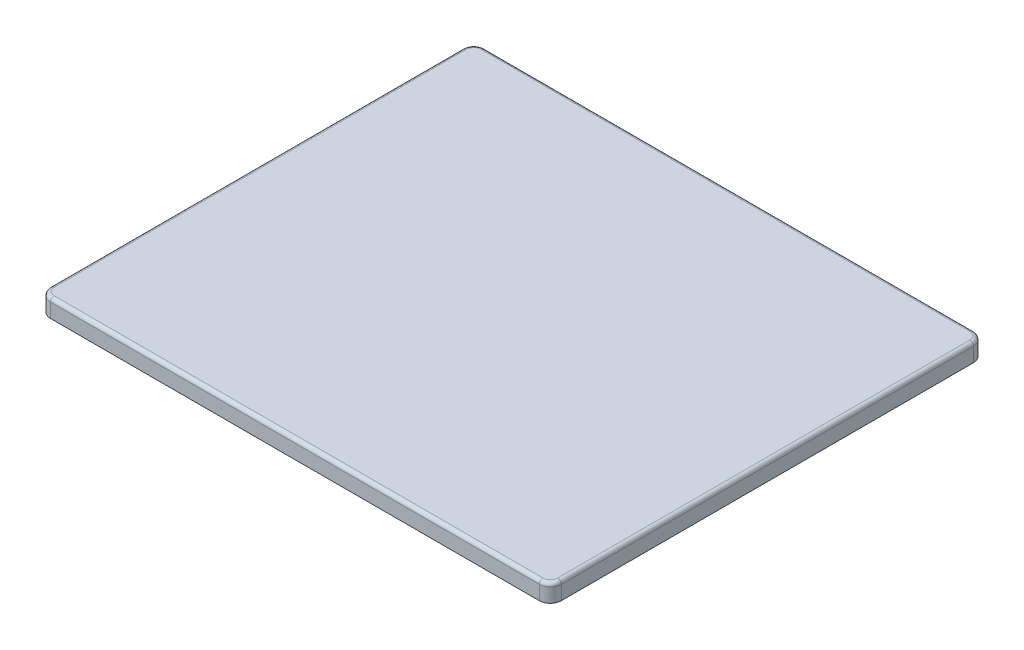
from build123d import *

# Parameters (mm, degrees)
SKETCH1_W           = 140
SKETCH1_H           = 119
BOSS_EXTRUDE1_DEPTH = 5
FILLET1_R           = 3
SHELL1_START        = -67
SHELL1_OUTLINE_W    = 2
SHELL1_OUTLINE_H    = 113
SHELL1_DEPTH        = 134
FILLET2_R           = 3
CUT_EXTRUDE1_DEPTH  = 1
CUT_EXTRUDE2_DEPTH  = 0.1
FILLET3_R           = 1
FILLET5_R           = 0.5


# Read off the part's stored shape, not the designer's step: Shell1
with BuildPart() as part:
    # Sketch1 → Boss-Extrude1 (new body)
    with BuildSketch(Plane(origin=(0, 0, 0), x_dir=(1, 0, 0), z_dir=(0, 1, 0))):
        Rectangle(SKETCH1_W, SKETCH1_H)
    extrude(amount=BOSS_EXTRUDE1_DEPTH)

    # Fillet1
    fillet1_edges = [part.edges().sort_by_distance(p)[0] for p in [
        (70, 2.5, 59.5),
        (-70, 2.5, 59.5),
        (-70, 2.5, -59.5),
        (70, 2.5, -59.5),
    ]]
    fillet(fillet1_edges, radius=FILLET1_R)

    # Shell1 outline → Shell1 (cut)
    with BuildSketch(Plane.YZ.offset(SHELL1_START)):
        with Locations((1, 0)):
            Rectangle(SHELL1_OUTLINE_W, SHELL1_OUTLINE_H)
    extrude(amount=SHELL1_DEPTH, mode=Mode.SUBTRACT)

    # Fillet2
    fillet2_edges = [part.edges().sort_by_distance(p)[0] for p in [
        (67, 1, -56.5),
        (-67, 1, -56.5),
        (-67, 1, 56.5),
        (67, 1, 56.5),
    ]]
    fillet(fillet2_edges, radius=FILLET2_R)

    # Sketch2 → Cut-Extrude1 (cut)
    with BuildSketch(Plane.XZ):
        with BuildLine():
            Line((68.5, -53.5), (68.5, 53.5))
            ThreePointArc((68.5, 53.5), (67.181980515, 56.681980515), (64, 58))
            Line((64, 58), (-64, 58))
            ThreePointArc((-64, 58), (-67.181980515, 56.681980515), (-68.5, 53.5))
            Line((-68.5, 53.5), (-68.5, -53.5))
            ThreePointArc((-68.5, -53.5), (-67.181980515, -56.681980515), (-64, -58))
            Line((-64, -58), (64, -58))
            ThreePointArc((64, -58), (67.181980515, -56.681980515), (68.5, -53.5))
        make_face()
        with BuildLine():
            Line((67, 53.5), (67, -53.5))
            ThreePointArc((67, -53.5), (66.121320344, -55.621320344), (64, -56.5))
            Line((64, -56.5), (-64, -56.5))
            ThreePointArc((-64, -56.5), (-66.121320344, -55.621320344), (-67, -53.5))
            Line((-67, -53.5), (-67, 53.5))
            ThreePointArc((-67, 53.5), (-66.121320344, 55.621320344), (-64, 56.5))
            Line((-64, 56.5), (64, 56.5))
            ThreePointArc((64, 56.5), (66.121320344, 55.621320344), (67, 53.5))
        make_face(mode=Mode.SUBTRACT)
    extrude(amount=-CUT_EXTRUDE1_DEPTH, mode=Mode.SUBTRACT)

    # Sketch3 → Cut-Extrude2 (cut)
    with BuildSketch(Plane.XZ):
        with BuildLine():
            Line((70, -56.5), (70, 56.5))
            ThreePointArc((70, 56.5), (69.121320344, 58.621320344), (67, 59.5))
            Line((67, 59.5), (-67, 59.5))
            ThreePointArc((-67, 59.5), (-69.121320344, 58.621320344), (-70, 56.5))
            Line((-70, 56.5), (-70, -56.5))
            ThreePointArc((-70, -56.5), (-69.121320344, -58.621320344), (-67, -59.5))
            Line((-67, -59.5), (67, -59.5))
            ThreePointArc((67, -59.5), (69.121320344, -58.621320344), (70, -56.5))
        make_face()
        with BuildLine():
            Line((-64, -58), (64, -58))
            ThreePointArc((64, -58), (67.181980515, -56.681980515), (68.5, -53.5))
            Line((68.5, -53.5), (68.5, 53.5))
            ThreePointArc((68.5, 53.5), (67.181980515, 56.681980515), (64, 58))
            Line((64, 58), (-64, 58))
            ThreePointArc((-64, 58), (-67.181980515, 56.681980515), (-68.5, 53.5))
            Line((-68.5, 53.5), (-68.5, -53.5))
            ThreePointArc((-68.5, -53.5), (-67.181980515, -56.681980515), (-64, -58))
        make_face(mode=Mode.SUBTRACT)
    extrude(amount=-CUT_EXTRUDE2_DEPTH, mode=Mode.SUBTRACT)

    # Fillet3
    fillet3_edges = [part.edges().sort_by_distance(p)[0] for p in [
        (70, 5, 0),
        (0, 5, 59.5),
        (0, 5, -59.5),
        (-70, 5, 0),
        (-69.121320344, 5, 58.621320344),
        (69.121320344, 5, -58.621320344),
        (-69.121320344, 5, -58.621320344),
        (69.121320344, 5, 58.621320344),
    ]]
    fillet(fillet3_edges, radius=FILLET3_R)

    # Fillet5
    fillet5_edges = [part.edges().sort_by_distance(p)[0] for p in [
        (-68.5, 0.1, 0),
        (-67.181980515, 0.1, -56.681980515),
        (0, 0.1, -58),
        (67.181980515, 0.1, -56.681980515),
        (68.5, 0.1, 0),
        (67.181980515, 0.1, 56.681980515),
        (0, 0.1, 58),
        (-67.181980515, 0.1, 56.681980515),
        (-67, 1, 0),
        (-66.121320344, 1, -55.621320344),
        (0, 1, -56.5),
        (66.121320344, 1, -55.621320344),
        (67, 1, 0),
        (66.121320344, 1, 55.621320344),
        (0, 1, 56.5),
        (-66.121320344, 1, 55.621320344),
    ]]
    fillet(fillet5_edges, radius=FILLET5_R)


solid = part.part
